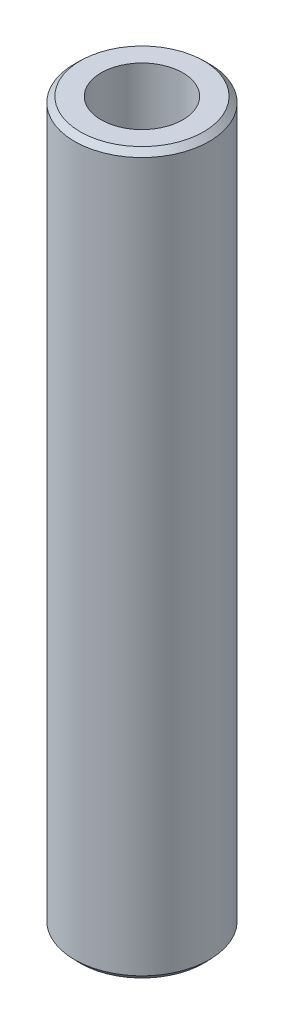
from build123d import *
from OCP.BRepFilletAPI import BRepFilletAPI_MakeChamfer

# Parameters (mm, degrees)
SKETCH1_R           = 55
BOSS_EXTRUDE1_DEPTH = 587.910503703
SKETCH2_R           = 33.333810362
CUT_EXTRUDE1_DEPTH  = 594.033523811
CHAMFER1_SIZE       = 4.451664833
CHAMFER1_SIZE2      = 4.672719145


with BuildPart() as part:
    # Sketch1 → Boss-Extrude1 (new body)
    with BuildSketch(Plane(origin=(0, 0, 0), x_dir=(1, 0, 0), z_dir=(0, 1, 0))):
        Circle(SKETCH1_R)
    extrude(amount=BOSS_EXTRUDE1_DEPTH)

    # Sketch2 → Cut-Extrude1 (cut, through all)
    with BuildSketch(Plane(origin=(0, 0, 0), x_dir=(1, 0, 0), z_dir=(0, 1, 0))):
        Circle(SKETCH2_R)
    extrude(amount=CUT_EXTRUDE1_DEPTH, mode=Mode.SUBTRACT)

    # Chamfer1: one chamfer whose edges measure the first distance from different faces: ONE call of the kernel's chamfer builder (chamfer() names one face for all edges)
    chamfer1_edges_1 = [part.edges().sort_by_distance(p)[0] for p in [
        (-55, 587.910503703, 0),
    ]]
    chamfer1_side_1 = [part.faces().sort_by_distance(p)[0] for p in [
        (-55, 293.955251851, 0),
    ]]
    chamfer1_edges_2 = [part.edges().sort_by_distance(p)[0] for p in [
        (-55, 0, 0),
    ]]
    chamfer1_side_2 = [part.faces().sort_by_distance(p)[0] for p in [
        (-53.444365081, 0, 0),
    ]]
    chamfer1 = BRepFilletAPI_MakeChamfer(part.part.solid().wrapped)
    for e in chamfer1_edges_1:
        chamfer1.Add(CHAMFER1_SIZE, CHAMFER1_SIZE2, e.wrapped, chamfer1_side_1[0].wrapped)  # the first distance lies on this face
    for e in chamfer1_edges_2:
        chamfer1.Add(CHAMFER1_SIZE, CHAMFER1_SIZE2, e.wrapped, chamfer1_side_2[0].wrapped)  # the first distance lies on this face
    add(Compound.cast(chamfer1.Shape()), mode=Mode.REPLACE)


solid = part.part
